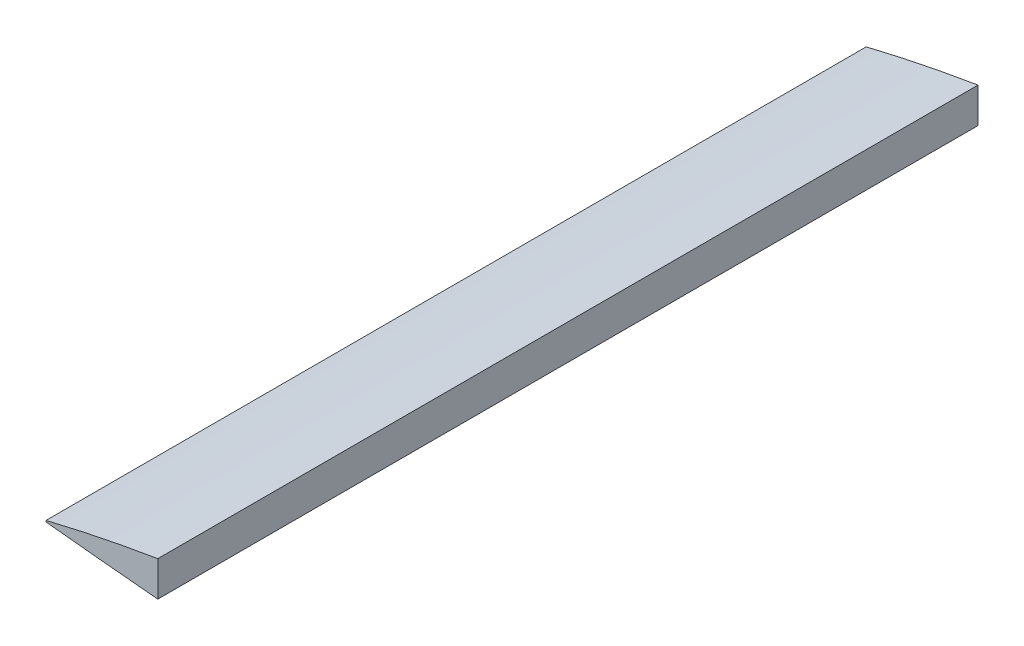
from build123d import *

# Parameters (mm, degrees)
BOSS_EXTRUDE1_DEPTH = 612
SKETCH2_W           = 21
SKETCH2_H           = 11.5
CUT_EXTRUDE1_DEPTH  = 13


with BuildPart() as part:
    # Sketch1 → Boss-Extrude1 (new body)
    with BuildSketch(Plane.XY):
        with BuildLine():
            Line((-237.3661, 17.502280368), (-237.3661, -8.674289956))
            add(Edge.make_bspline(
                [(-237.3661, -8.674289956), (-239.475083316, -8.483098289), (-245.080837993, -7.974903856), (-253.991881888, -7.146922519), (-263.889008858, -6.214616162), (-273.154176998, -5.32687884), (-281.728490591, -4.49257301), (-289.557033039, -3.71898722), (-296.589425041, -3.013864946), (-302.78010049, -2.383682538), (-308.088897631, -1.837830744), (-312.480728812, -1.376034218), (-315.927726107, -1.022678485), (-318.404741576, -0.737439563), (-319.900347138, -0.617044832), (-320.574918687, -0.50340935), (-320.753795962, -0.504046046), (-320.765, -0.504085926)],
                knots=[0, 0, 0, 0, 0.075810952, 0.201508279, 0.320388141, 0.43169539, 0.534719075, 0.628797147, 0.713321079, 0.787740393, 0.851567051, 0.904379655, 0.945827345, 0.975633259, 0.993597432, 0.999598973, 1, 1, 1, 1], degree=3))
            Line((-320.765, -0.504085926), (-320.765, 0.512293238))
            add(Edge.make_bspline(
                [(-237.3661, 17.502280368), (-239.80186616, 17.098302008), (-245.728570145, 16.115342236), (-254.934959794, 14.475311701), (-264.776350168, 12.647435041), (-273.967245237, 10.858568398), (-282.453543525, 9.139266434), (-290.184778643, 7.514392277), (-297.115470623, 6.009399781), (-303.205072817, 4.648335133), (-308.418205135, 3.453718605), (-312.72476491, 2.445888541), (-316.100039766, 1.642515192), (-318.524733585, 1.057899144), (-319.973889731, 0.705575825), (-320.613290589, 0.549358599), (-320.765, 0.512293238)],
                knots=[0, 0, 0, 0, 0.087007005, 0.211705365, 0.329527113, 0.439740645, 0.541660709, 0.634652346, 0.718134669, 0.791584505, 0.854539888, 0.906603358, 0.947445002, 0.976805146, 0.994496602, 1, 1, 1, 1], degree=3))
        make_face()
    extrude(amount=BOSS_EXTRUDE1_DEPTH)

    # Sketch2 → Cut-Extrude1 (cut)
    with BuildSketch(Plane.XY.offset(83.9)):
        with Locations((-250.574, -3.303)):
            Rectangle(SKETCH2_W, SKETCH2_H)
    extrude(amount=CUT_EXTRUDE1_DEPTH, mode=Mode.SUBTRACT)


solid = part.part
